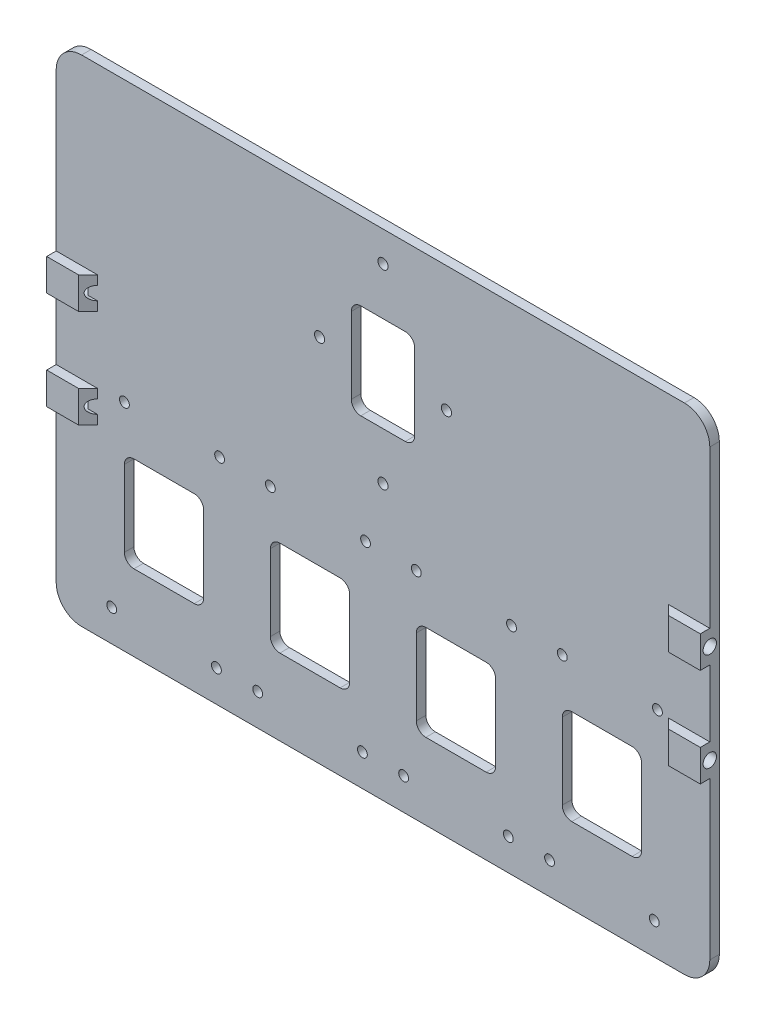
from build123d import *

# Parameters (mm, degrees)
SKETCH1_R           = 1.55
SKETCH1_R_2         = 1.6
BOSS_EXTRUDE1_DEPTH = 3
CUT_EXTRUDE3_REACH  = 131.236
SKETCH3_W           = 10
SKETCH3_H           = 6
BOSS_EXTRUDE2_DEPTH = 10
BOSS_EXTRUDE3_START = -206
SKETCH3_4_W         = 10
SKETCH3_4_H         = 6
BOSS_EXTRUDE3_DEPTH = 10
SKETCH3_6_R         = 2.1
CUT_EXTRUDE4_DEPTH  = 10
CUT_EXTRUDE5_START  = -196
SKETCH3_7_R         = 2.1
CUT_EXTRUDE5_DEPTH  = 10
CHAMFER1_SIZE       = 3


with BuildPart() as part:
    # Sketch1 → Boss-Extrude1 (new body)
    with BuildSketch(Plane(origin=(0, 0, 0), x_dir=(0, 1, 0), z_dir=(0, 0, 1))):
        with BuildLine():
            Line((-70, -103), (70, -103))
            ThreePointArc((70, -103), (75.656854249, -100.656854249), (78, -95))
            Line((78, -95), (78, 95))
            ThreePointArc((78, 95), (75.656854249, 100.656854249), (70, 103))
            Line((70, 103), (-70, 103))
            ThreePointArc((-70, 103), (-75.656854249, 100.656854249), (-78, 95))
            Line((-78, 95), (-78, -95))
            ThreePointArc((-78, -95), (-75.656854249, -100.656854249), (-70, -103))
        make_face()
        with Locations(Location((-68, -52.5, 0), (0, 0, 270))):
            Circle(SKETCH1_R, mode=Mode.SUBTRACT)
        with Locations(Location((-68, -85.5, 0), (0, 0, 270))):
            Circle(SKETCH1_R, mode=Mode.SUBTRACT)
        with Locations(Location((-10, -86.5, 0), (0, 0, 270))):
            Circle(SKETCH1_R, mode=Mode.SUBTRACT)
        with Locations(Location((-10, -56.5, 0), (0, 0, 270))):
            Circle(SKETCH1_R, mode=Mode.SUBTRACT)
        with Locations(Location((-68, -6.5, 0), (0, 0, 270))):
            Circle(SKETCH1_R, mode=Mode.SUBTRACT)
        with Locations(Location((-68, -39.5, 0), (0, 0, 270))):
            Circle(SKETCH1_R, mode=Mode.SUBTRACT)
        with Locations(Location((-10, -40.5, 0), (0, 0, 270))):
            Circle(SKETCH1_R, mode=Mode.SUBTRACT)
        with Locations(Location((-10, -10.5, 0), (0, 0, 270))):
            Circle(SKETCH1_R, mode=Mode.SUBTRACT)
        with Locations(Location((-68, 39.5, 0), (0, 0, 270))):
            Circle(SKETCH1_R, mode=Mode.SUBTRACT)
        with Locations(Location((-68, 6.5, 0), (0, 0, 270))):
            Circle(SKETCH1_R, mode=Mode.SUBTRACT)
        with Locations(Location((-10, 5.5, 0), (0, 0, 270))):
            Circle(SKETCH1_R, mode=Mode.SUBTRACT)
        with Locations(Location((-10, 35.5, 0), (0, 0, 270))):
            Circle(SKETCH1_R, mode=Mode.SUBTRACT)
        with Locations(Location((-68, 85.5, 0), (0, 0, 270))):
            Circle(SKETCH1_R, mode=Mode.SUBTRACT)
        with Locations(Location((-68, 52.5, 0), (0, 0, 270))):
            Circle(SKETCH1_R, mode=Mode.SUBTRACT)
        with Locations(Location((-10, 51.5, 0), (0, 0, 270))):
            Circle(SKETCH1_R, mode=Mode.SUBTRACT)
        with Locations(Location((-10, 81.5, 0), (0, 0, 270))):
            Circle(SKETCH1_R, mode=Mode.SUBTRACT)
        with Locations(Location((8.503950992, 0, 0), (0, 0, 270))):
            Circle(SKETCH1_R_2, mode=Mode.SUBTRACT)
        with Locations(Location((38.503950992, 20, 0), (0, 0, 270))):
            Circle(SKETCH1_R_2, mode=Mode.SUBTRACT)
        with Locations(Location((68.503950992, 0, 0), (0, 0, 270))):
            Circle(SKETCH1_R_2, mode=Mode.SUBTRACT)
        with Locations(Location((38.503950992, -20, 0), (0, 0, 270))):
            Circle(SKETCH1_R_2, mode=Mode.SUBTRACT)
    extrude(amount=BOSS_EXTRUDE1_DEPTH)

    # Sketch4 → Cut-Extrude3 (cut, up to next)
    with BuildSketch(Plane.XY.offset(3), mode=Mode.PRIVATE) as cut_extrude3_sk1:
        with BuildLine():
            Line((-78.5, -24), (-59.5, -24))
            ThreePointArc((-59.5, -24), (-57.378679656, -24.878679656), (-56.5, -27))
            Line((-56.5, -27), (-56.5, -51))
            ThreePointArc((-56.5, -51), (-57.378679656, -53.121320344), (-59.5, -54))
            Line((-59.5, -54), (-78.5, -54))
            ThreePointArc((-78.5, -54), (-80.621320344, -53.121320344), (-81.5, -51))
            Line((-81.5, -51), (-81.5, -27))
            ThreePointArc((-81.5, -27), (-80.621320344, -24.878679656), (-78.5, -24))
        make_face()
    cut_extrude3_tool1 = extrude(cut_extrude3_sk1.sketch, amount=-CUT_EXTRUDE3_REACH, mode=Mode.PRIVATE) & part.part
    # Sketch4 → Cut-Extrude3 (cut, up to next)
    with BuildSketch(Plane.XY.offset(3), mode=Mode.PRIVATE) as cut_extrude3_sk2:
        with BuildLine():
            Line((-35.5, -27), (-35.5, -51))
            ThreePointArc((-35.5, -51), (-34.621320344, -53.121320344), (-32.5, -54))
            Line((-32.5, -54), (-13.5, -54))
            ThreePointArc((-13.5, -54), (-11.378679656, -53.121320344), (-10.5, -51))
            Line((-10.5, -51), (-10.5, -27))
            ThreePointArc((-10.5, -27), (-11.378679656, -24.878679656), (-13.5, -24))
            Line((-13.5, -24), (-32.5, -24))
            ThreePointArc((-32.5, -24), (-34.621320344, -24.878679656), (-35.5, -27))
        make_face()
    cut_extrude3_tool2 = extrude(cut_extrude3_sk2.sketch, amount=-CUT_EXTRUDE3_REACH, mode=Mode.PRIVATE) & part.part
    # Sketch4 → Cut-Extrude3 (cut, up to next)
    with BuildSketch(Plane.XY.offset(3), mode=Mode.PRIVATE) as cut_extrude3_sk3:
        with BuildLine():
            Line((10.5, -27), (10.5, -51))
            ThreePointArc((10.5, -51), (11.378679656, -53.121320344), (13.5, -54))
            Line((13.5, -54), (32.5, -54))
            ThreePointArc((32.5, -54), (34.621320344, -53.121320344), (35.5, -51))
            Line((35.5, -51), (35.5, -27))
            ThreePointArc((35.5, -27), (34.621320344, -24.878679656), (32.5, -24))
            Line((32.5, -24), (13.5, -24))
            ThreePointArc((13.5, -24), (11.378679656, -24.878679656), (10.5, -27))
        make_face()
    cut_extrude3_tool3 = extrude(cut_extrude3_sk3.sketch, amount=-CUT_EXTRUDE3_REACH, mode=Mode.PRIVATE) & part.part
    # Sketch4 → Cut-Extrude3 (cut, up to next)
    with BuildSketch(Plane.XY.offset(3), mode=Mode.PRIVATE) as cut_extrude3_sk4:
        with BuildLine():
            Line((56.5, -27), (56.5, -51))
            ThreePointArc((56.5, -51), (57.378679656, -53.121320344), (59.5, -54))
            Line((59.5, -54), (78.5, -54))
            ThreePointArc((78.5, -54), (80.621320344, -53.121320344), (81.5, -51))
            Line((81.5, -51), (81.5, -27))
            ThreePointArc((81.5, -27), (80.621320344, -24.878679656), (78.5, -24))
            Line((78.5, -24), (59.5, -24))
            ThreePointArc((59.5, -24), (57.378679656, -24.878679656), (56.5, -27))
        make_face()
    cut_extrude3_tool4 = extrude(cut_extrude3_sk4.sketch, amount=-CUT_EXTRUDE3_REACH, mode=Mode.PRIVATE) & part.part
    # Sketch4 → Cut-Extrude3 (cut, up to next)
    with BuildSketch(Plane.XY.offset(3), mode=Mode.PRIVATE) as cut_extrude3_sk5:
        with BuildLine():
            Line((-7, 53.503950992), (7, 53.503950992))
            ThreePointArc((7, 53.503950992), (9.121320344, 52.625271335), (10, 50.503950992))
            Line((10, 50.503950992), (10, 26.503950992))
            ThreePointArc((10, 26.503950992), (9.121320344, 24.382630648), (7, 23.503950992))
            Line((7, 23.503950992), (-7, 23.503950992))
            ThreePointArc((-7, 23.503950992), (-9.121320344, 24.382630648), (-10, 26.503950992))
            Line((-10, 26.503950992), (-10, 50.503950992))
            ThreePointArc((-10, 50.503950992), (-9.121320344, 52.625271335), (-7, 53.503950992))
        make_face()
    cut_extrude3_tool5 = extrude(cut_extrude3_sk5.sketch, amount=-CUT_EXTRUDE3_REACH, mode=Mode.PRIVATE) & part.part
    add(cut_extrude3_tool1.solids().sort_by_distance((-69, -39, 3))[0], mode=Mode.SUBTRACT)
    add(cut_extrude3_tool2.solids().sort_by_distance((-23, -39, 3))[0], mode=Mode.SUBTRACT)
    add(cut_extrude3_tool3.solids().sort_by_distance((23, -39, 3))[0], mode=Mode.SUBTRACT)
    add(cut_extrude3_tool4.solids().sort_by_distance((69, -39, 3))[0], mode=Mode.SUBTRACT)
    add(cut_extrude3_tool5.solids().sort_by_distance((0, 38.503951, 3))[0], mode=Mode.SUBTRACT)

    # Sketch3 → Boss-Extrude2 (add)
    with BuildSketch(Plane.YZ.offset(103)):
        with Locations((-15.5, 3)):
            Rectangle(SKETCH3_W, SKETCH3_H)
        with Locations((15.5, 3)):
            Rectangle(SKETCH3_W, SKETCH3_H)
    extrude(amount=-BOSS_EXTRUDE2_DEPTH)

    # Sketch3<4> → Boss-Extrude3 (add)
    with BuildSketch(Plane.YZ.offset(103).offset(BOSS_EXTRUDE3_START)):
        with Locations((-15.5, 3)):
            Rectangle(SKETCH3_4_W, SKETCH3_4_H)
        with Locations((15.5, 3)):
            Rectangle(SKETCH3_4_W, SKETCH3_4_H)
    extrude(amount=BOSS_EXTRUDE3_DEPTH)

    # Sketch3<6> → Cut-Extrude4 (cut)
    with BuildSketch(Plane.YZ.offset(103)):
        with Locations(Location((-15.5, 3, 0), (0, 0, 270))):
            Circle(SKETCH3_6_R)
        with Locations(Location((15.5, 3, 0), (0, 0, 270))):
            Circle(SKETCH3_6_R)
    extrude(amount=-CUT_EXTRUDE4_DEPTH, mode=Mode.SUBTRACT)

    # Sketch3<7> → Cut-Extrude5 (cut)
    with BuildSketch(Plane.YZ.offset(103).offset(CUT_EXTRUDE5_START)):
        with Locations(Location((-15.5, 3, 0), (0, 0, 270))):
            Circle(SKETCH3_7_R)
        with Locations(Location((15.5, 3, 0), (0, 0, 270))):
            Circle(SKETCH3_7_R)
    extrude(amount=-CUT_EXTRUDE5_DEPTH, mode=Mode.SUBTRACT)

    # Chamfer1
    # the kernel refuses this chamfer: 3 mm, written as the material it adds along each edge
    with BuildSketch(Plane(origin=(93, -9.884951036, 3), x_dir=(-0.9996219169112968, 0, -0.027495876610586334), z_dir=(0, -1, 0))) as chamfer1_piece_1_section:
        Polygon((CHAMFER1_SIZE * 0.999621916911, -CHAMFER1_SIZE * 0.0274958766106), (-CHAMFER1_SIZE * 0.0274958766106, -CHAMFER1_SIZE * 0.999621916911), (0, 0), align=None)
    chamfer1_piece_1 = extrude(amount=10.615048964, mode=Mode.PRIVATE)
    chamfer1_piece_1 = split(chamfer1_piece_1, bisect_by=Plane(origin=(90.522066824, -10.5, 3.477933176), z_dir=(0, -1, 0)), keep=Keep.TOP, mode=Mode.PRIVATE)
    chamfer1_piece_1 = chamfer1_piece_1 - Plane(origin=(90.522066824, -15.5, 3), x_dir=(0, 0, -1), z_dir=(1, 0, 0)) * Cylinder(2.1, 34, mode=Mode.PRIVATE)
    add(chamfer1_piece_1)
    with BuildSketch(Plane(origin=(93, 21.115048964, 3), x_dir=(-0.9996219169112968, 0, -0.027495876610586334), z_dir=(0, -1, 0))) as chamfer1_piece_2_section:
        Polygon((CHAMFER1_SIZE * 0.999621916911, -CHAMFER1_SIZE * 0.0274958766106), (-CHAMFER1_SIZE * 0.0274958766106, -CHAMFER1_SIZE * 0.999621916911), (0, 0), align=None)
    chamfer1_piece_2 = extrude(amount=10.615048964, mode=Mode.PRIVATE)
    chamfer1_piece_2 = split(chamfer1_piece_2, bisect_by=Plane(origin=(90.522066824, 20.5, 3.477933176), z_dir=(0, -1, 0)), keep=Keep.TOP, mode=Mode.PRIVATE)
    chamfer1_piece_2 = chamfer1_piece_2 - Plane(origin=(90.522066824, 15.5, 3), x_dir=(0, 0, -1), z_dir=(1, 0, 0)) * Cylinder(2.1, 34, mode=Mode.PRIVATE)
    add(chamfer1_piece_2)
    with BuildSketch(Plane(origin=(-93, -9.884951036, 3), x_dir=(0.9996219169112968, 0, -0.027495876610586334), z_dir=(0, -1, 0))) as chamfer1_piece_3_section:
        Polygon((CHAMFER1_SIZE * 0.999621916911, CHAMFER1_SIZE * 0.0274958766106), (-CHAMFER1_SIZE * 0.0274958766106, CHAMFER1_SIZE * 0.999621916911), (0, 0), align=None)
    chamfer1_piece_3 = extrude(amount=10.615048964, mode=Mode.PRIVATE)
    chamfer1_piece_3 = split(chamfer1_piece_3, bisect_by=Plane(origin=(-90.522066824, -10.5, 3.477933176), z_dir=(0, -1, 0)), keep=Keep.TOP, mode=Mode.PRIVATE)
    chamfer1_piece_3 = chamfer1_piece_3 - Plane(origin=(-90.522066824, -15.5, 3), x_dir=(0, 0, -1), z_dir=(1, 0, 0)) * Cylinder(2.1, 34, mode=Mode.PRIVATE)
    add(chamfer1_piece_3)
    with BuildSketch(Plane(origin=(-93, 21.115048964, 3), x_dir=(0.9996219169112968, 0, -0.027495876610586334), z_dir=(0, -1, 0))) as chamfer1_piece_4_section:
        Polygon((CHAMFER1_SIZE * 0.999621916911, CHAMFER1_SIZE * 0.0274958766106), (-CHAMFER1_SIZE * 0.0274958766106, CHAMFER1_SIZE * 0.999621916911), (0, 0), align=None)
    chamfer1_piece_4 = extrude(amount=10.615048964, mode=Mode.PRIVATE)
    chamfer1_piece_4 = split(chamfer1_piece_4, bisect_by=Plane(origin=(-90.522066824, 20.5, 3.477933176), z_dir=(0, -1, 0)), keep=Keep.TOP, mode=Mode.PRIVATE)
    chamfer1_piece_4 = chamfer1_piece_4 - Plane(origin=(-90.522066824, 15.5, 3), x_dir=(0, 0, -1), z_dir=(1, 0, 0)) * Cylinder(2.1, 34, mode=Mode.PRIVATE)
    add(chamfer1_piece_4)


solid = part.part
